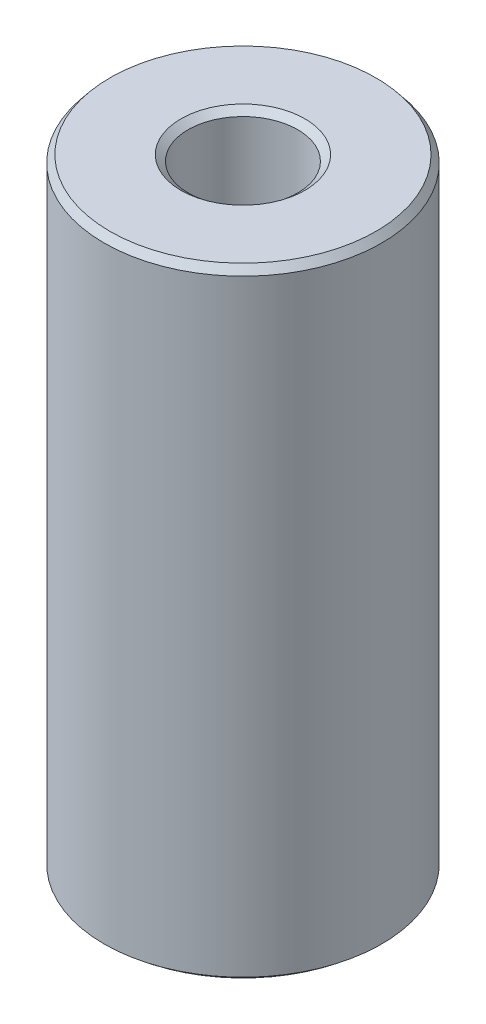
from build123d import *
from OCP.BRepFilletAPI import BRepFilletAPI_MakeChamfer

# Parameters (mm, degrees)
SKETCH1_R           = 57.5
BOSS_EXTRUDE1_DEPTH = 256.877143534
SKETCH2_R           = 22.707823194
CUT_EXTRUDE1_DEPTH  = 270.440841132
CHAMFER1_SIZE       = 2.98116046
CHAMFER1_SIZE2      = 2.400644987


with BuildPart() as part:
    # Sketch1 → Boss-Extrude1 (new body)
    with BuildSketch(Plane(origin=(0, 0, 0), x_dir=(1, 0, 0), z_dir=(0, 1, 0))):
        Circle(SKETCH1_R)
    extrude(amount=BOSS_EXTRUDE1_DEPTH)

    # Sketch2 → Cut-Extrude1 (cut, through all)
    with BuildSketch(Plane(origin=(0, 0, 0), x_dir=(1, 0, 0), z_dir=(0, 1, 0))):
        Circle(SKETCH2_R)
    extrude(amount=CUT_EXTRUDE1_DEPTH, mode=Mode.SUBTRACT)

    # Chamfer1: one chamfer whose edges measure the first distance from different faces: ONE call of the kernel's chamfer builder (chamfer() names one face for all edges)
    chamfer1_edges_1 = [part.edges().sort_by_distance(p)[0] for p in [
        (-22.707823194, 256.877143534, 0),
    ]]
    chamfer1_side_1 = [part.faces().sort_by_distance(p)[0] for p in [
        (-55.873654403, 256.877143534, 0),
    ]]
    chamfer1_edges_2 = [part.edges().sort_by_distance(p)[0] for p in [
        (-22.707823194, 0, 0),
    ]]
    chamfer1_side_2 = [part.faces().sort_by_distance(p)[0] for p in [
        (-22.707823194, 128.438571767, 0),
    ]]
    chamfer1_edges_3 = [part.edges().sort_by_distance(p)[0] for p in [
        (-57.5, 0, 0),
    ]]
    chamfer1_side_3 = [part.faces().sort_by_distance(p)[0] for p in [
        (-55.873654403, 0, 0),
    ]]
    chamfer1_edges_4 = [part.edges().sort_by_distance(p)[0] for p in [
        (-57.5, 256.877143534, 0),
    ]]
    chamfer1_side_4 = [part.faces().sort_by_distance(p)[0] for p in [
        (-57.5, 128.438571767, 0),
    ]]
    chamfer1 = BRepFilletAPI_MakeChamfer(part.part.solid().wrapped)
    for e in chamfer1_edges_1:
        chamfer1.Add(CHAMFER1_SIZE, CHAMFER1_SIZE2, e.wrapped, chamfer1_side_1[0].wrapped)  # the first distance lies on this face
    for e in chamfer1_edges_2:
        chamfer1.Add(CHAMFER1_SIZE, CHAMFER1_SIZE2, e.wrapped, chamfer1_side_2[0].wrapped)  # the first distance lies on this face
    for e in chamfer1_edges_3:
        chamfer1.Add(CHAMFER1_SIZE, CHAMFER1_SIZE2, e.wrapped, chamfer1_side_3[0].wrapped)  # the first distance lies on this face
    for e in chamfer1_edges_4:
        chamfer1.Add(CHAMFER1_SIZE, CHAMFER1_SIZE2, e.wrapped, chamfer1_side_4[0].wrapped)  # the first distance lies on this face
    add(Compound.cast(chamfer1.Shape()), mode=Mode.REPLACE)


solid = part.part
